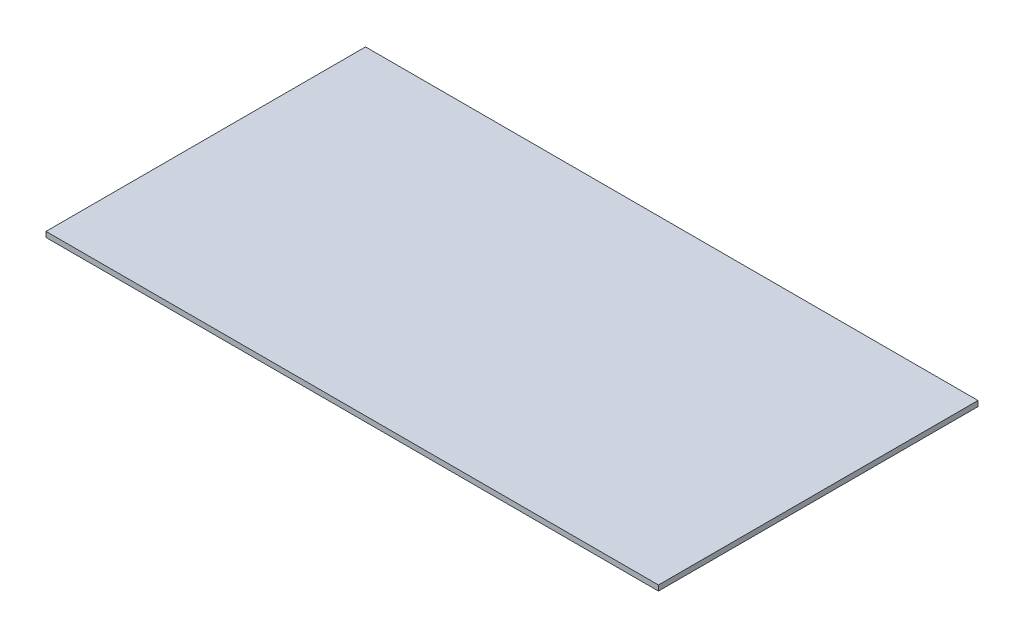
from build123d import *

# Parameters (mm, degrees)
SKETCH1_W           = 584.2
SKETCH1_H           = 304.8
BOSS_EXTRUDE1_DEPTH = 5.08


with BuildPart() as part:
    # Sketch1 → Boss-Extrude1 (new body)
    with BuildSketch(Plane(origin=(0, 0, 0), x_dir=(1, 0, 0), z_dir=(0, 1, 0))):
        with Locations((292.1, 152.4)):
            Rectangle(SKETCH1_W, SKETCH1_H)
    extrude(amount=BOSS_EXTRUDE1_DEPTH)


solid = part.part
